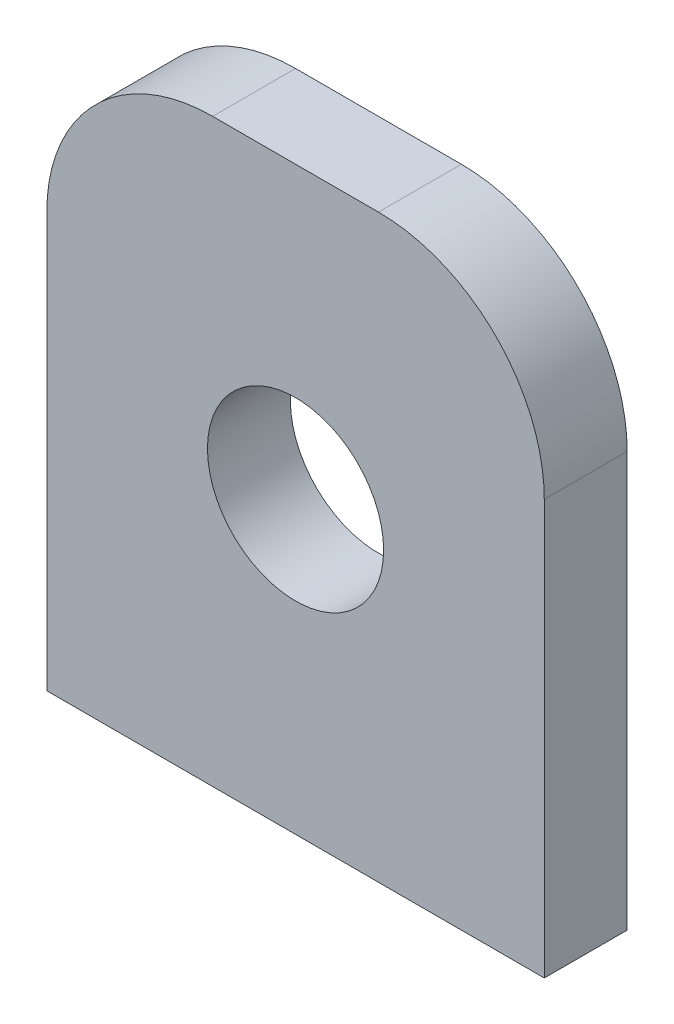
from build123d import *

# Parameters (mm, degrees)
SKETCH1_R                  = 13.49375
BOSS_EXTRUDE1_DEPTH        = 6.35
F_10_32_TAPPED_HOLE1_D     = 4.0386
F_10_32_TAPPED_HOLE1_DEPTH = 12.02944
F_10_32_TAPPED_HOLE1_TIP   = 1.213317848


with BuildPart() as part:
    # Sketch1 → Boss-Extrude1 (new, symmetric)
    with BuildSketch(Plane.XY):
        with BuildLine():
            Line((38.1, -44.45), (-38.1, -44.45))
            Line((-38.1, -44.45), (-38.1, 19.05))
            ThreePointArc((-38.1, 19.05), (-30.660512242, 37.010512242), (-12.7, 44.45))
            Line((-12.7, 44.45), (12.7, 44.45))
            ThreePointArc((12.7, 44.45), (30.660512242, 37.010512242), (38.1, 19.05))
            Line((38.1, 19.05), (38.1, -44.45))
        make_face()
        Circle(SKETCH1_R, mode=Mode.SUBTRACT)
    extrude(amount=BOSS_EXTRUDE1_DEPTH, both=True)

    # #10-32 Tapped Hole1
    with Locations(Plane(origin=(0, -44.45, 0), x_dir=(-1, 0, 0), z_dir=(0, -1, 0))):
        with Locations((19.05, 0), (-19.05, 0)):
            Hole(F_10_32_TAPPED_HOLE1_D / 2, depth=F_10_32_TAPPED_HOLE1_DEPTH)
            with Locations((0, 0, -(F_10_32_TAPPED_HOLE1_DEPTH + F_10_32_TAPPED_HOLE1_TIP / 2))):  # 118° drill point
                Cone(0, F_10_32_TAPPED_HOLE1_D / 2, F_10_32_TAPPED_HOLE1_TIP, mode=Mode.SUBTRACT)


solid = part.part
